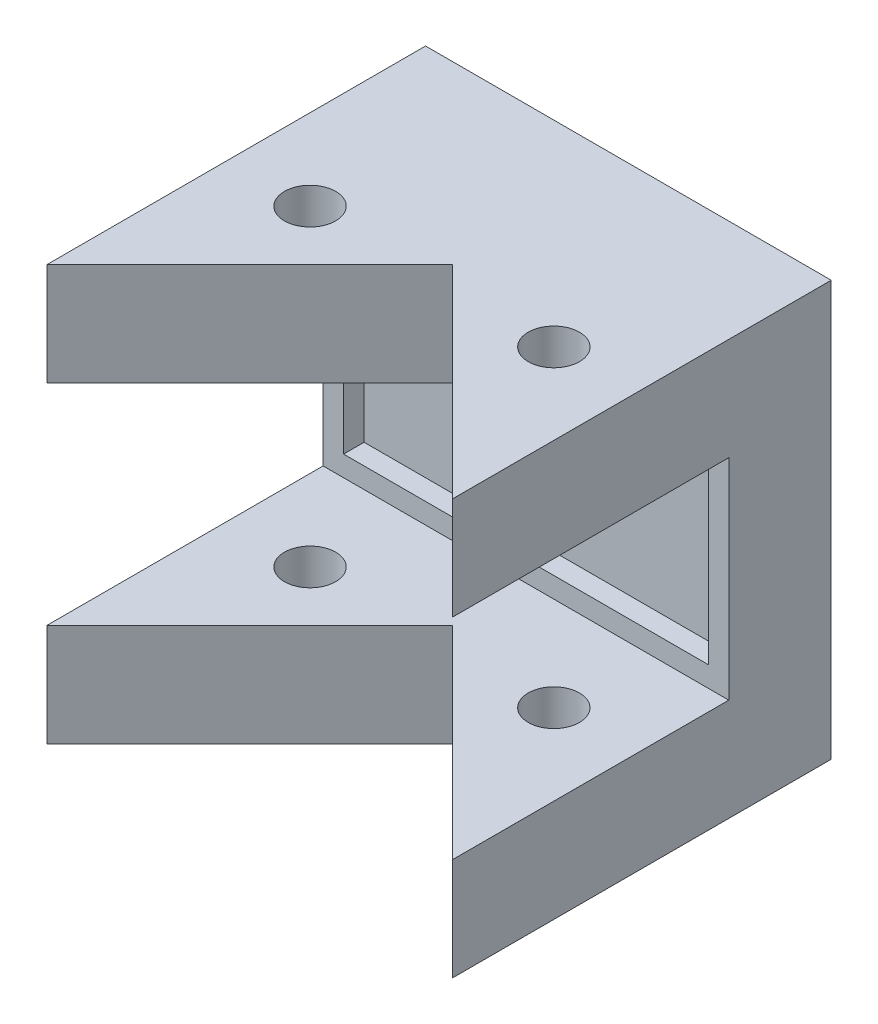
from build123d import *

# Parameters (mm, degrees)
SKETCH1_W                = 39.6
SKETCH1_H                = 30
BOSS_EXTRUDE1_DEPTH      = 5
BOSS_EXTRUDE2_DEPTH      = 5.25
BOSS_EXTRUDE2_DEPTH_BACK = 4.75
BOSS_EXTRUDE3_DEPTH      = 5.25
BOSS_EXTRUDE3_DEPTH_BACK = 4.75
SKETCH4_W                = 39.6
SKETCH4_H                = 5
BOSS_EXTRUDE4_DEPTH      = 5.25
SKETCH5_W                = 39.6
SKETCH5_H                = 5
BOSS_EXTRUDE5_DEPTH      = 5.25
SKETCH8_W                = 39.6
SKETCH8_H                = 40.5
BOSS_EXTRUDE6_DEPTH      = 5
SKETCH9_W                = 35.6
SKETCH9_H                = 16.5
CUT_EXTRUDE1_DEPTH       = 2
HOLE1_START              = -5.25
HOLE1_OUTLINE_R          = 2.5
HOLE1_DEPTH              = 40.5
HOLE2_START              = -5.25
HOLE2_OUTLINE_R          = 2.5
HOLE2_DEPTH              = 40.5


# Read off the part's stored shape, not the designer's step: Hole1, Hole2
with BuildPart() as part:
    # Sketch1 → Boss-Extrude1 (new body)
    with BuildSketch(Plane.XY):
        with Locations((19.8, 15)):
            Rectangle(SKETCH1_W, SKETCH1_H)
    extrude(amount=BOSS_EXTRUDE1_DEPTH)

    # Sketch2 → Boss-Extrude2 (add, two sides: drawn at the far end of the back side and taken through both)
    with BuildSketch(Plane.XZ.offset(-BOSS_EXTRUDE2_DEPTH_BACK)):
        Polygon((0, 5), (0, 31.975), (19.798989873, 12.176010127), (39.6, 31.977020254), (39.6, 5), align=None)
    extrude(amount=BOSS_EXTRUDE2_DEPTH + BOSS_EXTRUDE2_DEPTH_BACK)

    # Sketch3 → Boss-Extrude3 (add, two sides: drawn at the far end of the back side and taken through both)
    with BuildSketch(Plane(origin=(0, 30, 0), x_dir=(1, 0, 0), z_dir=(0, 1, 0)).offset(-BOSS_EXTRUDE3_DEPTH_BACK)):
        Polygon((0, -5), (0, -31.975), (19.798989873, -12.176010127), (39.6, -31.977020254), (39.6, -5), align=None)
    extrude(amount=BOSS_EXTRUDE3_DEPTH + BOSS_EXTRUDE3_DEPTH_BACK)

    # Sketch4 → Boss-Extrude4 (add)
    with BuildSketch(Plane(origin=(0, 30, 0), x_dir=(1, 0, 0), z_dir=(0, 1, 0))):
        with Locations((19.8, -2.5)):
            Rectangle(SKETCH4_W, SKETCH4_H)
    extrude(amount=BOSS_EXTRUDE4_DEPTH)

    # Sketch5 → Boss-Extrude5 (add)
    with BuildSketch(Plane.XZ):
        with Locations((19.8, 2.5)):
            Rectangle(SKETCH5_W, SKETCH5_H)
    extrude(amount=BOSS_EXTRUDE5_DEPTH)

    # Sketch8 → Boss-Extrude6 (add)
    with BuildSketch(Plane(origin=(0, 0, 0), x_dir=(-1, 0, 0), z_dir=(0, 0, -1))):
        with Locations((-19.8, 15)):
            Rectangle(SKETCH8_W, SKETCH8_H)
    extrude(amount=BOSS_EXTRUDE6_DEPTH)

    # Sketch9 → Cut-Extrude1 (cut)
    with BuildSketch(Plane.XY.offset(5)):
        with Locations((19.8, 15)):
            Rectangle(SKETCH9_W, SKETCH9_H)
    extrude(amount=-CUT_EXTRUDE1_DEPTH, mode=Mode.SUBTRACT)

    # Hole1 outline → Hole1 (cut)
    with BuildSketch(Plane(origin=(0, 0, 0), x_dir=(1, 0, 0), z_dir=(0, 1, 0)).offset(HOLE1_START)):
        with Locations((7.9, -14.175505063)):
            Circle(HOLE1_OUTLINE_R)
    extrude(amount=HOLE1_DEPTH, mode=Mode.SUBTRACT)

    # Hole2 outline → Hole2 (cut)
    with BuildSketch(Plane(origin=(0, 0, 0), x_dir=(1, 0, 0), z_dir=(0, 1, 0)).offset(HOLE2_START)):
        with Locations((31.7, -14.177525317)):
            Circle(HOLE2_OUTLINE_R)
    extrude(amount=HOLE2_DEPTH, mode=Mode.SUBTRACT)


solid = part.part
